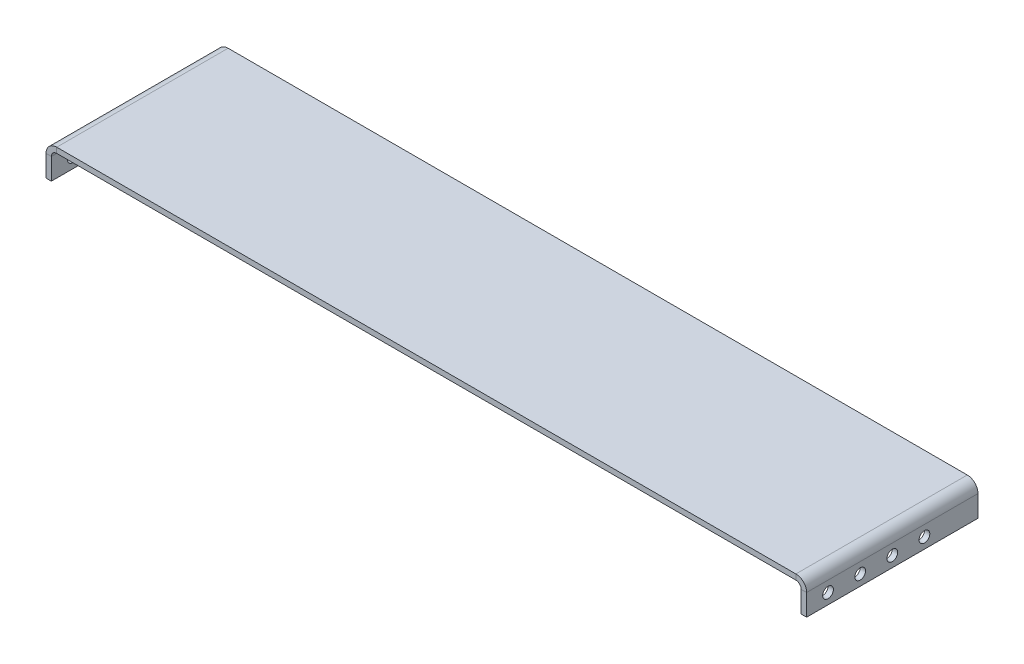
from build123d import *

# Parameters (mm, degrees)
SKETCH1_W            = 450.85
SKETCH1_H            = 101.6
BOSS_EXTRUDE1_DEPTH  = 19.05
SKETCH2_R            = 3.175
CUT_EXTRUDE1_DEPTH   = 455.102703141
CONVERT_SOLID2_START = -50.8
CONVERT_SOLID2_DEPTH = 101.6


# Read off the part's stored shape, not the designer's step: Convert-Solid2
with BuildPart() as part:
    # Sketch1 → Boss-Extrude1 (new body)
    with BuildSketch(Plane(origin=(0, 0, 0), x_dir=(1, 0, 0), z_dir=(0, 1, 0))):
        Rectangle(SKETCH1_W, SKETCH1_H)
    extrude(amount=BOSS_EXTRUDE1_DEPTH)

    # Sketch2 → Cut-Extrude1 (cut, through all)
    with BuildSketch(Plane(origin=(225.425, 0, 0), x_dir=(0, 0, -1), z_dir=(1, 0, 0))):
        with Locations((-38.1, 6.35)):
            Circle(SKETCH2_R)
        with Locations((-19.05, 6.35)):
            Circle(SKETCH2_R)
        with Locations((0, 6.35)):
            Circle(SKETCH2_R)
        with Locations((19.05, 6.35)):
            Circle(SKETCH2_R)
    extrude(amount=-CUT_EXTRUDE1_DEPTH, mode=Mode.SUBTRACT)

    # Convert-Solid2 outline → Convert-Solid2 (cut)
    with BuildSketch(Plane.XY.offset(CONVERT_SOLID2_START)):
        with BuildLine():
            ThreePointArc((219.075, 19.05), (223.565128061, 17.190128061), (225.425, 12.7))
            Line((225.425, 12.7), (225.425, 19.05))
            Line((225.425, 19.05), (219.075, 19.05))
        make_face()
        with BuildLine():
            ThreePointArc((-225.425, 12.7), (-223.565128061, 17.190128061), (-219.075, 19.05))
            Line((-219.075, 19.05), (-225.425, 19.05))
            Line((-225.425, 19.05), (-225.425, 12.7))
        make_face()
        with BuildLine():
            Line((-222.25, 0), (222.25, 0))
            Line((222.25, 0), (222.25, 12.7))
            ThreePointArc((222.25, 12.7), (221.32006403, 14.94506403), (219.075, 15.875))
            Line((219.075, 15.875), (-219.075, 15.875))
            ThreePointArc((-219.075, 15.875), (-221.32006403, 14.94506403), (-222.25, 12.7))
            Line((-222.25, 12.7), (-222.25, 0))
        make_face()
    extrude(amount=CONVERT_SOLID2_DEPTH, mode=Mode.SUBTRACT)


solid = part.part
